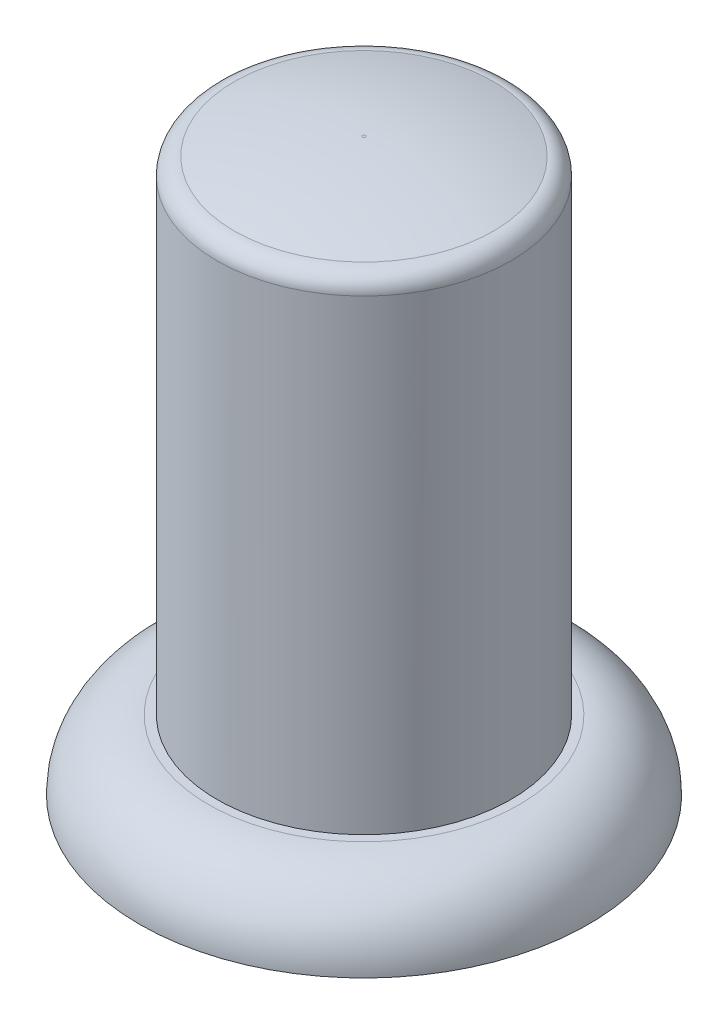
from build123d import *

# Parameters (mm, degrees)
SKETCH1_R           = 4.25
BOSS_EXTRUDE1_DEPTH = 16
FILLET1_R           = 0.5
SKETCH3_R           = 3.75
BOSS_EXTRUDE3_DEPTH = 0.5
FILLET2_R           = 14
SKETCH5_R           = 3.5
CUT_EXTRUDE1_DEPTH  = 5
SKETCH6_R           = 3
CUT_EXTRUDE2_DEPTH  = 10
SKETCH7_W           = 1.5
SKETCH7_H           = 5.196152422
BOSS_EXTRUDE5_DEPTH = 10
SKETCH8_R           = 6.5
BOSS_EXTRUDE6_DEPTH = 2
SKETCH9_R           = 3.5
CUT_EXTRUDE3_DEPTH  = 2
FILLET3_R           = 2


# Some blends are built 0.0001 mm under size
with BuildPart() as part:
    # Sketch1 → Boss-Extrude1 (new body)
    with BuildSketch(Plane(origin=(0, 0, 0), x_dir=(1, 0, 0), z_dir=(0, 1, 0))):
        with Locations(Location((0, 0, 0), (0, 0, 270))):
            Circle(SKETCH1_R)
    extrude(amount=BOSS_EXTRUDE1_DEPTH)

    # Fillet1
    fillet1_edges = [part.edges().sort_by_distance(p)[0] for p in [
        (0, 16, -4.25),
    ]]
    fillet(fillet1_edges, radius=FILLET1_R)

    # Sketch3 → Boss-Extrude3 (add)
    with BuildSketch(Plane(origin=(0, 16, 0), x_dir=(1, 0, 0), z_dir=(0, 1, 0))):
        with Locations(Location((0, 0, 0), (0, 0, 270))):
            Circle(SKETCH3_R)
    extrude(amount=BOSS_EXTRUDE3_DEPTH)

    # Fillet2
    # the kernel refuses this fillet: 14 mm, written as the material it takes off along each edge
    with BuildSketch(Plane(origin=(0, 16.5, 0), x_dir=(0, 0, 1), z_dir=(-1, 0, 0))) as fillet2_piece_1:
        with BuildLine():
            CenterArc((0.041900756, -14), FILLET2_R, 74.641114419, 15.358885581)
            Line((0.041900756, 0), (0.041900756, 0.28))
            Line((0.041900756, 0.28), (3.75, 0.28))
            Line((3.75, 0.28), (4.03, 0))
            ThreePointArc((4.03, 0), (4.03, -0.25), (3.824161985, -0.23))
            Line((3.824161985, -0.23), (3.75, -0.5))
        make_face()
    revolve(axis=Axis((0, 16.5, 0), (0, 1, 0)), mode=Mode.SUBTRACT)

    # Sketch5 → Cut-Extrude1 (cut)
    with BuildSketch(Plane.XZ):
        with Locations(Location((0, 0, 0), (0, 0, 270))):
            Circle(SKETCH5_R)
    extrude(amount=-CUT_EXTRUDE1_DEPTH, mode=Mode.SUBTRACT)

    # Sketch6 → Cut-Extrude2 (cut)
    with BuildSketch(Plane.XZ.offset(-5)):
        with Locations(Location((0, 0, 0), (0, 0, 270))):
            Circle(SKETCH6_R)
    extrude(amount=-CUT_EXTRUDE2_DEPTH, mode=Mode.SUBTRACT)

    # Sketch7 → Boss-Extrude5 (add)
    with BuildSketch(Plane.XZ.offset(-15)):
        with Locations((2.25, 0)):
            Rectangle(SKETCH7_W, SKETCH7_H)
    extrude(amount=BOSS_EXTRUDE5_DEPTH)

    # Sketch8 → Boss-Extrude6 (add)
    with BuildSketch(Plane.XZ):
        with Locations(Location((0, 0, 0), (0, 0, 270))):
            Circle(SKETCH8_R)
    extrude(amount=-BOSS_EXTRUDE6_DEPTH)

    # Sketch9 → Cut-Extrude3 (cut)
    with BuildSketch(Plane.XZ):
        with Locations(Location((0, 0, 0), (0, 0, 270))):
            Circle(SKETCH9_R)
    extrude(amount=-CUT_EXTRUDE3_DEPTH, mode=Mode.SUBTRACT)

    # Fillet3
    fillet3_edges = [part.edges().sort_by_distance(p)[0] for p in [
        (0, 2, 6.5),
    ]]
    fillet(fillet3_edges, radius=FILLET3_R - 0.0001)  # a hair under: the kernel refuses the full size


solid = part.part
